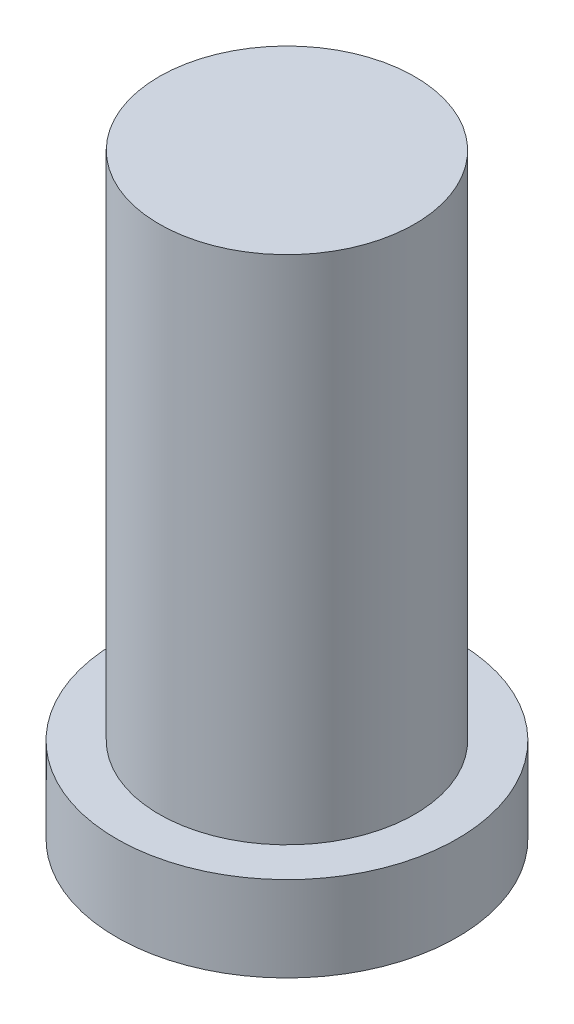
from build123d import *


with BuildPart() as part:
    # Sketch1 → Revolve1 (revolve)
    with BuildSketch(Plane.XY):
        Polygon((0, 0), (10, 0), (10, 5), (7.5, 5), (7.5, 35), (0, 35), align=None)
    revolve(axis=Axis((0, 40, 0), (0, -1, 0)))


solid = part.part
